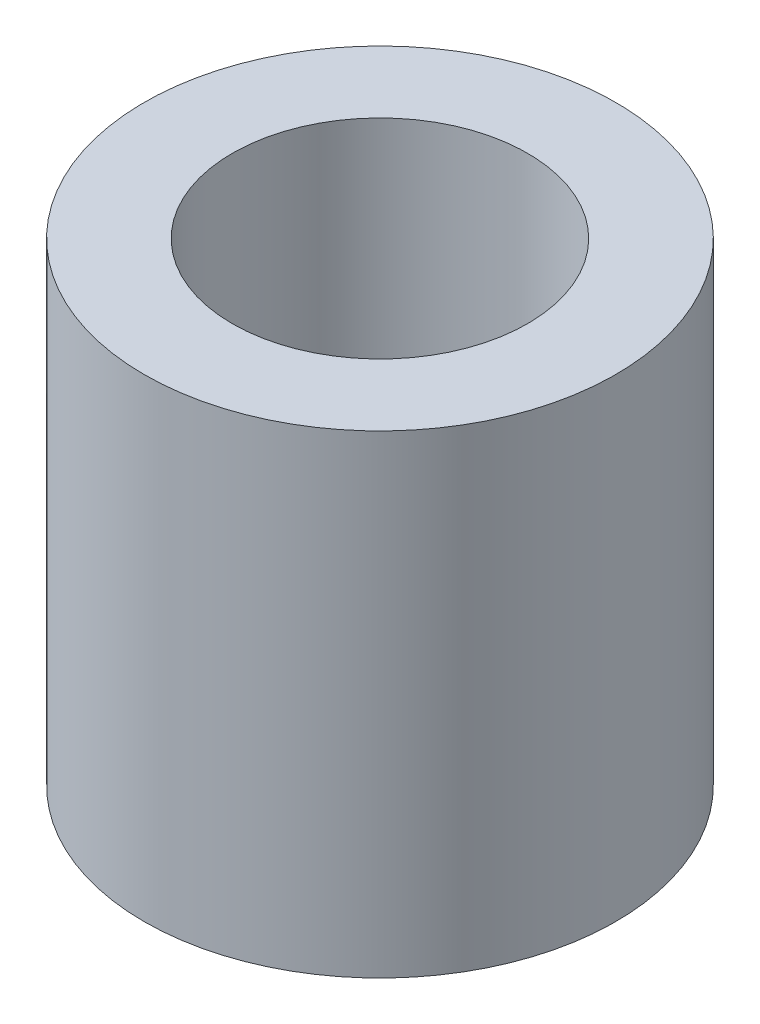
from build123d import *

# Parameters (mm, degrees)
SKETCH1_R           = 12.5
BOSS_EXTRUDE1_DEPTH = 25.12413973
SKETCH2_R           = 7.828234003
CUT_EXTRUDE1_DEPTH  = 31.720065058


with BuildPart() as part:
    # Sketch1 → Boss-Extrude1 (new body)
    with BuildSketch(Plane(origin=(0, 0, 0), x_dir=(1, 0, 0), z_dir=(0, 1, 0))):
        Circle(SKETCH1_R)
    extrude(amount=BOSS_EXTRUDE1_DEPTH)

    # Sketch2 → Cut-Extrude1 (cut, through all)
    with BuildSketch(Plane(origin=(0, 0, 0), x_dir=(1, 0, 0), z_dir=(0, 1, 0))):
        Circle(SKETCH2_R)
    extrude(amount=CUT_EXTRUDE1_DEPTH, mode=Mode.SUBTRACT)


solid = part.part
